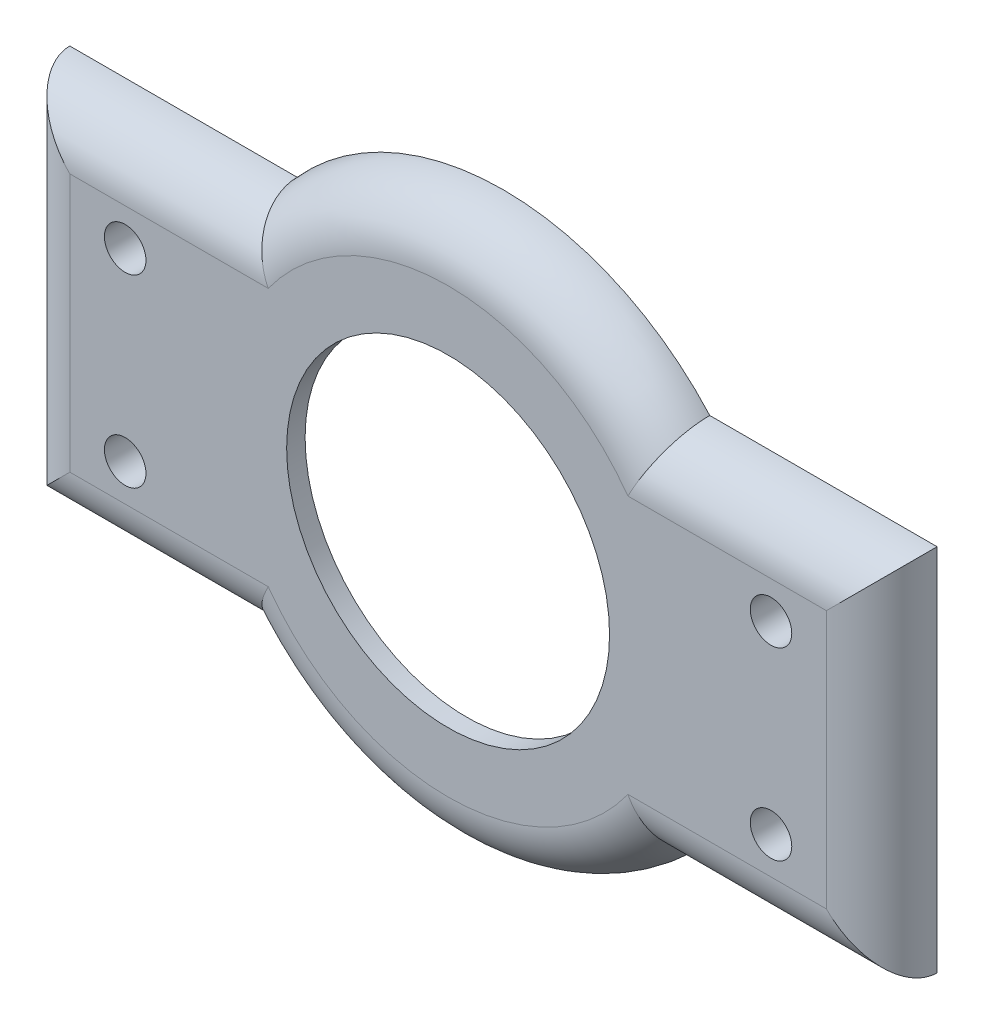
from build123d import *

# Parameters (mm, degrees)
SKETCH1_R            = 30
BOSS_EXTRUDE1_DEPTH  = 2
BOSS_EXTRUDE2_START  = 4
SKETCH2_R            = 30
SKETCH2_R_2          = 25
BOSS_EXTRUDE2_DEPTH  = 4
BOSS_EXTRUDE3_REACH  = 44.849
SKETCH3_W            = 94
SKETCH3_H            = 40
SKETCH4_R            = 25
CUT_EXTRUDE1_DEPTH   = 4
SKETCH5_R            = 17.5
CUT_EXTRUDE2_DEPTH   = 56.901699437
FILLET1_R            = 6
M4_CLEARANCE_HOLE1_D = 4.5


with BuildPart() as part:
    # Sketch1 → Boss-Extrude1 (new body)
    with BuildSketch(Plane.XY):
        Circle(SKETCH1_R)
    extrude(amount=BOSS_EXTRUDE1_DEPTH)

    # Sketch2 → Boss-Extrude2 (add)
    with BuildSketch(Plane(origin=(0, 0, 0), x_dir=(-1, 0, 0), z_dir=(0, 0, -1)).offset(BOSS_EXTRUDE2_START)):
        Circle(SKETCH2_R)
        Circle(SKETCH2_R_2, mode=Mode.SUBTRACT)
    extrude(amount=-BOSS_EXTRUDE2_DEPTH)

    # Boss-Extrude3: up to this face of the body (flat: up to its plane)
    boss_extrude3_end = Plane(part.part.faces().sort_by_distance((0, 0, 2))[0])
    # Sketch3 → Boss-Extrude3 (add, up to the picked face)
    with BuildSketch(Plane(origin=(0, 0, -4), x_dir=(-1, 0, 0), z_dir=(0, 0, -1)), mode=Mode.PRIVATE) as boss_extrude3_sk1:
        Rectangle(SKETCH3_W, SKETCH3_H)
    boss_extrude3_tool1 = split(extrude(boss_extrude3_sk1.sketch, amount=-BOSS_EXTRUDE3_REACH, mode=Mode.PRIVATE), bisect_by=boss_extrude3_end, keep=Keep.BOTH, mode=Mode.PRIVATE)
    add(boss_extrude3_tool1.solids().sort_by(Axis((0, 0, -4), (0, 0, 1)))[0])

    # Sketch4 → Cut-Extrude1 (cut)
    with BuildSketch(Plane(origin=(0, 0, -4), x_dir=(-1, 0, 0), z_dir=(0, 0, -1))):
        Circle(SKETCH4_R)
    extrude(amount=-CUT_EXTRUDE1_DEPTH, mode=Mode.SUBTRACT)

    # Sketch5 → Cut-Extrude2 (cut, through all)
    with BuildSketch(Plane(origin=(0, 0, 0), x_dir=(-1, 0, 0), z_dir=(0, 0, -1))):
        Circle(SKETCH5_R)
    extrude(amount=-CUT_EXTRUDE2_DEPTH, mode=Mode.SUBTRACT)

    # Fillet1
    fillet1_edges = [part.edges().sort_by_distance(p)[0] for p in [
        (47, 0, 2),
        (34.680339887, -20, 2),
        (34.680339887, 20, 2),
        (0, 30, 2),
        (0, -30, 2),
        (-34.680339887, -20, 2),
        (-47, 0, 2),
        (-34.680339887, 20, 2),
    ]]
    fillet(fillet1_edges, radius=FILLET1_R - 0.0001)  # a hair under: the kernel refuses the full size

    # M4 Clearance Hole1 (through all)
    with Locations(Plane.XY.offset(2)):
        with Locations((-35, 10), (-35, -10), (35, 10), (35, -10)):
            Hole(M4_CLEARANCE_HOLE1_D / 2)


solid = part.part
